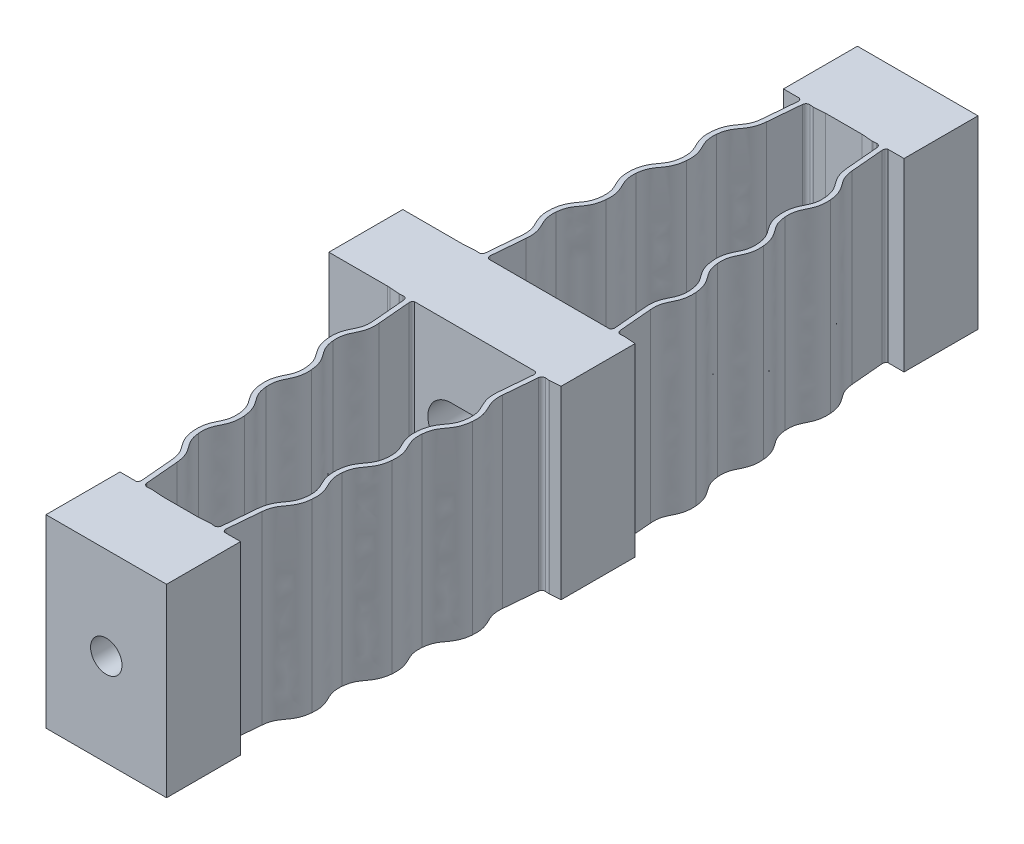
from build123d import *

# Parameters (mm, degrees)
SKETCH1_W               = 23.64481877
SKETCH1_H               = 10.16
BOSS_EXTRUDE1_DEPTH     = 25.4
SKETCH1_W_2             = 16.5608
BOSS_EXTRUDE1_2_DEPTH   = 25.4
EXTRUDE_THIN1_DEPTH     = 25.4
EXTRUDE_THIN2_START     = -25.4
EXTRUDE_THIN2_DEPTH     = 25.4
LPATTERN1_COUNT         = 3
LPATTERN1_PITCH         = 10.16
BOSS_EXTRUDE2_DEPTH     = 25.4
CUT_EXTRUDE1_DEPTH      = 25.4
BOSS_EXTRUDE3_DEPTH     = 25.4
CUT_EXTRUDE2_DEPTH      = 25.4
FILLET1_R               = 0.508
SKETCH9_W               = 10.16
SKETCH9_H               = 25.4
BOSS_EXTRUDE4_DEPTH     = 8.255
FILLET2_R               = 5.08
SKETCH10_R              = 1.4605
CUT_EXTRUDE3_DEPTH      = 25.4
CUT_EXTRUDE4_DEPTH      = 117.058270096
CUT_EXTRUDE4_DEPTH_BACK = 117.058270096
SKETCH11_R              = 2.159
CUT_EXTRUDE5_DEPTH      = 10.16


# Read off the part's stored shape, not the designer's step: Extrude-Thin2
with BuildPart() as part:
    # Sketch1 → Boss-Extrude1 (new body)
    with BuildSketch(Plane(origin=(0, 0, 0), x_dir=(1, 0, 0), z_dir=(0, 1, 0))):
        Rectangle(SKETCH1_W, SKETCH1_H)
    extrude(amount=BOSS_EXTRUDE1_DEPTH)



with BuildPart() as body_2:
    # Sketch1 → Boss-Extrude1 2 (new body)
    with BuildSketch(Plane(origin=(0, 0, 0), x_dir=(1, 0, 0), z_dir=(0, 1, 0))):
        with Locations((0, 50.64535253)):
            Rectangle(SKETCH1_W_2, SKETCH1_H)
    extrude(amount=BOSS_EXTRUDE1_2_DEPTH)


with BuildPart() as part_1:
    add(part.part)

    add(body_2.part)  # Extrude-Thin1 merges body 2
    # Sketch2 → Extrude-Thin1 (add)
    with BuildSketch(Plane(origin=(0, 25.4, 0), x_dir=(1, 0, 0), z_dir=(0, 1, 0))):
        Polygon((-5.739143489, 45.594131357), (-6.181894662, 40.53346229), (-5.524007684, 40.475904638), (-5.081256511, 45.536573704), align=None)
        Polygon((-8.623265896, 5.051221174), (-8.180514723, 10.11189024), (-8.838401701, 10.169447893), (-9.281152875, 5.108778826), align=None)
    extrude(amount=-EXTRUDE_THIN1_DEPTH)

    # Extrude-Thin2 outline → Extrude-Thin2 (add)
    with BuildSketch(Plane(origin=(0, 25.4, 0), x_dir=(1, 0, 0), z_dir=(0, 1, 0)).offset(EXTRUDE_THIN2_START)):
        with BuildLine():
            add(Edge.make_bspline(
                [(-6.40951003, 30.354566505), (-6.351288251, 31.020044487), (-6.407685349, 31.546834935), (-6.642282432, 32.434819765), (-6.992121273, 33.148700123), (-7.290694998, 33.766399708), (-7.487063444, 34.509683468), (-7.537425591, 34.948371639), (-7.432493563, 36.147750208), (-7.306719129, 36.571028425), (-6.98426409, 37.268921012), (-6.582963963, 37.825389569), (-6.114475937, 38.467675602), (-5.729245964, 39.301432592), (-5.582229463, 39.810426656), (-5.524007684, 40.475904638)],
                knots=[0, 0, 0, 0, 0.25, 0.25, 0.5, 0.75, 0.75, 1, 1, 1.25, 1.25, 1.5, 1.75, 1.75, 2, 2, 2, 2], degree=3))
            Line((-5.524007684, 40.475904638), (-6.181894662, 40.53346229))
            add(Edge.make_bspline(
                [(-6.181894662, 40.53346229), (-6.234360676, 39.933773006), (-6.36013511, 39.510494789), (-6.682590149, 38.812602202), (-7.083890276, 38.256133645), (-7.552378302, 37.613847612), (-7.937608275, 36.780090622), (-8.084624776, 36.271096558), (-8.201068335, 34.940140594), (-8.144671236, 34.413350146), (-7.910074154, 33.525365316), (-7.560235313, 32.811484959), (-7.261661588, 32.193785373), (-7.065293141, 31.450501613), (-7.014930995, 31.011813442), (-7.067397009, 30.412124158)],
                knots=[0, 0, 0, 0, 0.25, 0.25, 0.5, 0.75, 0.75, 1, 1, 1.25, 1.25, 1.5, 1.75, 1.75, 2, 2, 2, 2], degree=3))
            Line((-7.067397009, 30.412124158), (-6.40951003, 30.354566505))
        make_face()
    extrude_thin2 = extrude(amount=EXTRUDE_THIN2_DEPTH)

    # LPattern1: Extrude-Thin2 ×3
    with Locations(*[Vector(-0.08715574274765835, 0, 0.9961946980917455) * (i * LPATTERN1_PITCH) for i in range(1, LPATTERN1_COUNT)]):
        add(extrude_thin2)

    # Sketch4 → Boss-Extrude2 (add)
    with BuildSketch(Plane(origin=(0, 25.4, 0), x_dir=(1, 0, 0), z_dir=(0, 1, 0))):
        Polygon((-9.281152875, 5.108778826), (-10.293286688, 5.197329061), (-11.822409385, 5.08), (-8.952209385, 5.08), align=None)
    extrude(amount=-BOSS_EXTRUDE2_DEPTH)

    # Sketch5 → Cut-Extrude1 (cut)
    with BuildSketch(Plane(origin=(0, 25.4, 0), x_dir=(1, 0, 0), z_dir=(0, 1, 0))):
        Polygon((-8.620748075, 5.08), (-7.608614262, 4.991449765), (-6.454559396, 5.08), align=None)
    extrude(amount=-CUT_EXTRUDE1_DEPTH, mode=Mode.SUBTRACT)

    # Sketch6 → Boss-Extrude3 (add)
    with BuildSketch(Plane(origin=(0, 25.4, 0), x_dir=(1, 0, 0), z_dir=(0, 1, 0))):
        Polygon((-5.081256511, 45.536573704), (-4.069122697, 45.44802347), (-2.54, 45.56535253), (-5.4102, 45.56535253), align=None)
    extrude(amount=-BOSS_EXTRUDE3_DEPTH)

    # Sketch7 → Cut-Extrude2 (cut)
    with BuildSketch(Plane(origin=(0, 25.4, 0), x_dir=(1, 0, 0), z_dir=(0, 1, 0))):
        Polygon((-5.74166131, 45.56535253), (-6.753795124, 45.653902765), (-7.90784999, 45.56535253), align=None)
    extrude(amount=-CUT_EXTRUDE2_DEPTH, mode=Mode.SUBTRACT)

    # Fillet1
    fillet1_edges = [part_1.edges().sort_by_distance(p)[0] for p in [
        (-7.608614262, 12.7, -4.991449765),
        (-4.069122697, 12.7, -45.44802347),
        (-6.753795124, 12.7, -45.653902765),
        (-9.281152875, 12.7, -5.108778826),
        (-8.620748075, 12.7, -5.08),
        (-5.74166131, 12.7, -45.56535253),
        (-5.081256511, 12.7, -45.536573704),
        (-10.293286688, 12.7, -5.197329061),
    ]]
    fillet(fillet1_edges, radius=FILLET1_R)

    # Mirror6: part across plane


with BuildPart() as part_2:
    add(part_1.part)
    add(part_1.part.mirror(Plane(origin=(0, 0, 0), x_dir=(0, 0, 1), z_dir=(1, 0, 0))))

    # Mirror5: part across plane


with BuildPart() as part_3:
    add(part_2.part)
    add(part_2.part.mirror(Plane(origin=(0, 0, 0), x_dir=(1, 0, 0), z_dir=(0, 0, -1))))

    # Sketch9 → Boss-Extrude4 (add)
    with BuildSketch(Plane.ZY.offset(11.822409385)):
        with Locations((0, 12.7)):
            Rectangle(SKETCH9_W, SKETCH9_H)
    extrude(amount=BOSS_EXTRUDE4_DEPTH)

    # Fillet2
    # the kernel refuses this fillet: 5.08 mm, written as the material it adds along each edge
    with BuildSketch(Plane(origin=(-11.822409385, 0, 5.08), x_dir=(0.9970692146156075, 0, 0.07650477936583895), z_dir=(0, 1, 0))) as fillet2_piece_1:
        with BuildLine():
            CenterArc((FILLET2_R * 0.038308526718, -FILLET2_R), FILLET2_R, 90, 4.387688266)
            Line((-FILLET2_R * 0.0381962526478, -FILLET2_R * 0.00293078538439), (0, 0))
            Line((0, 0), (FILLET2_R * 0.038308526718, 0))
        make_face()
    extrude(amount=25.4)
    with BuildSketch(Plane(origin=(-11.822409385, 0, -5.08), x_dir=(0.9970692146156075, 0, -0.07650477936583895), z_dir=(0, 1, 0))) as fillet2_piece_2:
        with BuildLine():
            CenterArc((FILLET2_R * 0.038308526718, FILLET2_R), FILLET2_R, 265.612311734, 4.387688266)
            Line((-FILLET2_R * 0.0381962526478, FILLET2_R * 0.00293078538439), (0, 0))
            Line((0, 0), (FILLET2_R * 0.038308526718, 0))
        make_face()
    extrude(amount=25.4)

    # Sketch10 → Cut-Extrude3 (cut)
    with BuildSketch(Plane.ZY.offset(20.077409385)):
        with Locations((0, 21.59)):
            Circle(SKETCH10_R)
        with Locations((0, 3.81)):
            Circle(SKETCH10_R)
    extrude(amount=-CUT_EXTRUDE3_DEPTH, mode=Mode.SUBTRACT)

    # Sketch11 → Cut-Extrude4 (cut, two sides: drawn at the far end of the back side and taken through both)
    with BuildSketch(Plane.XY.offset(55.72535253).offset(-CUT_EXTRUDE4_DEPTH_BACK)):
        with Locations((0, 12.7)):
            Circle(SKETCH11_R)
    extrude(amount=CUT_EXTRUDE4_DEPTH + CUT_EXTRUDE4_DEPTH_BACK, mode=Mode.SUBTRACT)

    # Sketch12 → Cut-Extrude5 (cut)
    with BuildSketch(Plane.XY.offset(5.08)):
        with BuildLine():
            Line((-3.302, 9.525), (3.302, 9.525))
            ThreePointArc((3.302, 9.525), (6.477, 12.7), (3.302, 15.875))
            Line((3.302, 15.875), (-3.302, 15.875))
            ThreePointArc((-3.302, 15.875), (-6.477, 12.7), (-3.302, 9.525))
        make_face()
    extrude(amount=-CUT_EXTRUDE5_DEPTH, mode=Mode.SUBTRACT)


solid = part_3.part
